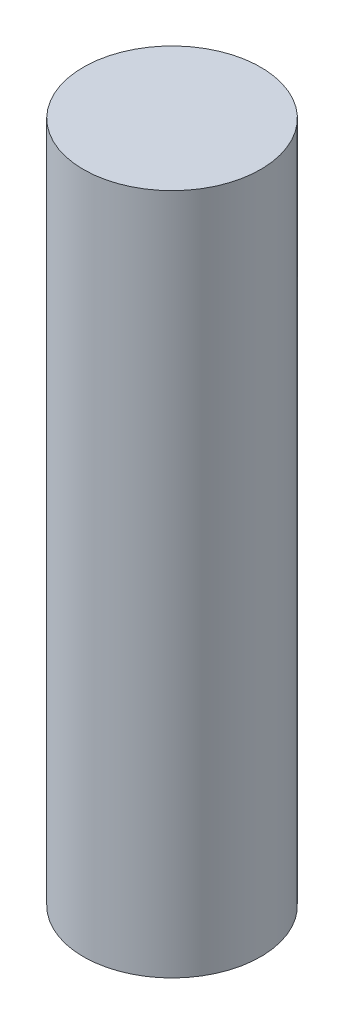
from build123d import *

# Parameters (mm, degrees)
SKETCH1_R           = 2.6
BOSS_EXTRUDE1_DEPTH = 20


with BuildPart() as part:
    # Sketch1 → Boss-Extrude1 (new body)
    with BuildSketch(Plane(origin=(0, 0, 0), x_dir=(1, 0, 0), z_dir=(0, 1, 0))):
        Circle(SKETCH1_R)
    extrude(amount=BOSS_EXTRUDE1_DEPTH)


solid = part.part
